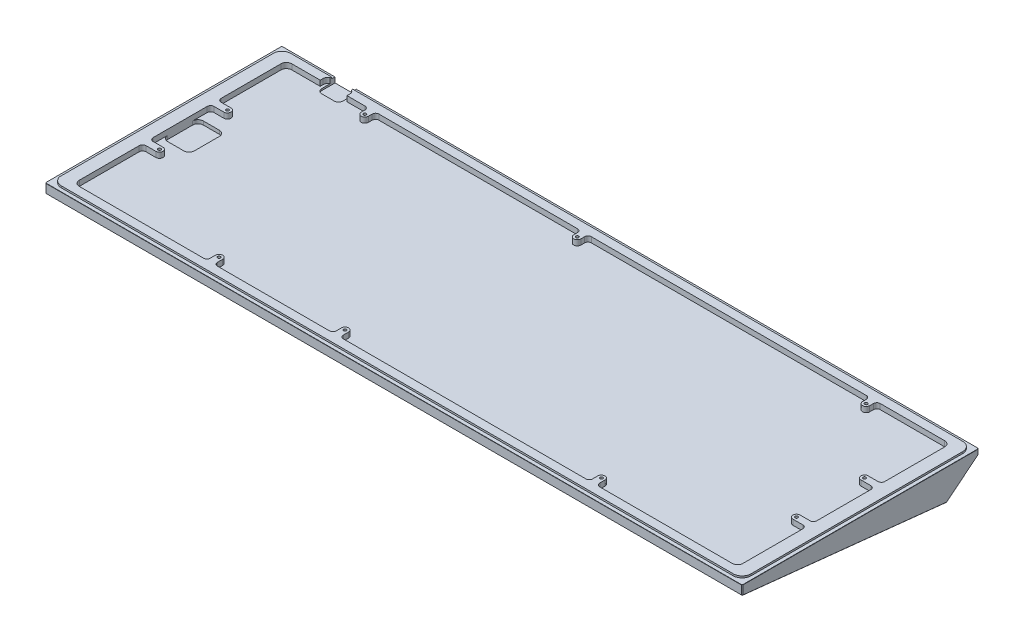
from build123d import *
from OCP.BRepFilletAPI import BRepFilletAPI_MakeChamfer

# Parameters (mm, degrees)
SKETCH1_W                 = 390.7
SKETCH1_H                 = 132.7
MAINBODY_DEPTH            = 18.5
SKETCH2_W                 = 390.7
SKETCH2_H                 = 132.7
SKETCH2_W_2               = 386.6
SKETCH2_H_2               = 128.6
ALIGMENTLIP_DEPTH         = 1
TYPINGANGLE_DEPTH         = 414.035143783
SKETCH4_W                 = 372
SKETCH4_H                 = 119.1
PCBCUTOUT_DEPTH           = 3
SKETCH13_W                = 15
SKETCH13_H                = 20
CUT_EXTRUDE4_DEPTH        = 2
FILLET2_R                 = 3
CHAMFER1_SIZE             = 0.5
CHAMFER1_SIZE_2           = 0.561801899
CHAMFER2_SIZE             = 0.1
SKETCH17_R                = 1
SKETCH17_W                = 2
SKETCH17_H                = 2
CUT_EXTRUDE5_DEPTH        = 1
SKETCH18_W                = 12
SKETCH18_H                = 4
CUT_EXTRUDE6_DEPTH        = 10
SKETCH12_W                = 15
SKETCH12_H                = 3.95
CUT_EXTRUDE3_DEPTH        = 3
FILLET1_R                 = 2.5
SKETCH19_R                = 2
SKETCH19_W                = 4
SKETCH19_H                = 4
SKETCH19_W_2              = 7.45
SKETCH19_H_2              = 4.8
BOSS_EXTRUDE1_DEPTH       = 3
FILLET3_R                 = 1.9
M2X0_4_TAPPED_HOLE1_D     = 1.6
M2X0_4_TAPPED_HOLE1_DEPTH = 4
M2X0_4_TAPPED_HOLE1_TIP   = 0.480688495
CHAMFER3_SIZE             = 0.1
FILLET4_R                 = 5
CUT_EXTRUDE7_REACH        = 414.392
SKETCH23_W                = 300
SKETCH23_H                = 70
FILLET5_R                 = 5


# Some blends are built 0.0001 mm under size
with BuildPart() as part:
    # Sketch1 → MainBody (new body)
    with BuildSketch(Plane(origin=(0, 0, 0), x_dir=(1, 0, 0), z_dir=(0, 1, 0))):
        with Locations((195.35, 66.35)):
            Rectangle(SKETCH1_W, SKETCH1_H)
    extrude(amount=MAINBODY_DEPTH)

    # Sketch2 → AligmentLip (cut)
    with BuildSketch(Plane(origin=(0, 18.5, 0), x_dir=(1, 0, 0), z_dir=(0, 1, 0))):
        with Locations((195.35, 66.35)):
            Rectangle(SKETCH2_W, SKETCH2_H)
        with Locations((195.35, 66.35)):
            Rectangle(SKETCH2_W_2, SKETCH2_H_2, mode=Mode.SUBTRACT)
    extrude(amount=-ALIGMENTLIP_DEPTH, mode=Mode.SUBTRACT)

    # Sketch3 → TypingAngle (cut, through all)
    with BuildSketch(Plane.ZY):
        Polygon((-114.79399123, 0), (-132.7, 14.5), (-132.7, 0), align=None)
        Polygon((0, 12.065334661), (-114.79399123, 0), (0, 0), align=None)
    extrude(amount=-TYPINGANGLE_DEPTH, mode=Mode.SUBTRACT)

    # Sketch4 → PCBCutout (cut)
    with BuildSketch(Plane(origin=(0, 18.5, 0), x_dir=(1, 0, 0), z_dir=(0, 1, 0))):
        with Locations((195.35, 66.35)):
            Rectangle(SKETCH4_W, SKETCH4_H)
    extrude(amount=-PCBCUTOUT_DEPTH, mode=Mode.SUBTRACT)

    # Sketch13 → Cut-Extrude4 (cut)
    with BuildSketch(Plane(origin=(0, 15.5, 0), x_dir=(1, 0, 0), z_dir=(0, 1, 0))):
        with Locations((16.85, 66.35)):
            Rectangle(SKETCH13_W, SKETCH13_H)
    extrude(amount=-CUT_EXTRUDE4_DEPTH, mode=Mode.SUBTRACT)

    # Fillet2
    fillet2_edges = [part.edges().sort_by_distance(p)[0] for p in [
        (9.35, 17, -6.8),
        (9.35, 17, -125.9),
        (381.35, 17, -125.9),
        (381.35, 17, -6.8),
        (9.35, 14.5, -56.35),
        (9.35, 14.5, -76.35),
        (24.35, 14.5, -76.35),
        (24.35, 14.5, -56.35),
    ]]
    fillet(fillet2_edges, radius=FILLET2_R)

    # Chamfer1
    chamfer1_edges_1 = [part.edges().sort_by_distance(p)[0] for p in [
        (0, 16, -132.7),
        (390.7, 16, -132.7),
        (390.7, 14.782667331, 0),
        (0, 14.782667331, 0),
        (0, 7.25, -123.746995615),
        (390.7, 7.25, -123.746995615),
        (0, 6.032667331, -57.396995615),
        (390.7, 6.032667331, -57.396995615),
    ]]
    chamfer1_edges_2 = [part.edges().sort_by_distance(p)[0] for p in [
        (195.35, 12.065334661, 0),
    ]]
    chamfer1_side_2 = [part.faces().sort_by_distance(p)[0] for p in [
        (195.35, 12.064289377, -0.009945219),
    ]]
    chamfer1 = BRepFilletAPI_MakeChamfer(part.part.solid().wrapped)
    for e in chamfer1_edges_1:
        chamfer1.Add(CHAMFER1_SIZE - 0.0001, e.wrapped)
    for e in chamfer1_edges_2:
        chamfer1.Add(CHAMFER1_SIZE_2 - 0.0001, CHAMFER1_SIZE - 0.0001, e.wrapped, chamfer1_side_2[0].wrapped)
    add(Compound.cast(chamfer1.Shape()), mode=Mode.REPLACE)  # a hair under: the kernel refuses the full size

    # Chamfer2
    chamfer2_edges = [part.edges().sort_by_distance(p)[0] for p in [
        (2.05, 18.5, -66.35),
    ]]
    chamfer(chamfer2_edges, length=CHAMFER2_SIZE)

    # Sketch17 → Cut-Extrude5 (cut)
    with BuildSketch(Plane(origin=(0, 11.933506406, -1.254262065), x_dir=(1, 0, 0), z_dir=(0, -0.9945218953682734, 0.10452846326765429))):
        with Locations((205.25, -52.238829109)):
            Circle(SKETCH17_R)
        with BuildLine():
            ThreePointArc((204.25, -52.238829109), (205.25, -51.238829109), (206.25, -52.238829109))
            Line((206.25, -52.238829109), (206.25, -49.738829109))
            ThreePointArc((206.25, -49.738829109), (205.25, -50.738829109), (204.25, -49.738829109))
            Line((204.25, -49.738829109), (204.25, -52.238829109))
        make_face()
        with Locations((205.25, -49.738829109)):
            Circle(SKETCH17_R)
        with Locations((201.75, -49.738829109)):
            Circle(SKETCH17_R)
        with BuildLine():
            ThreePointArc((200.75, -60.238829109), (201.75, -59.238829109), (202.75, -60.238829109))
            Line((202.75, -60.238829109), (202.75, -49.738829109))
            ThreePointArc((202.75, -49.738829109), (201.75, -50.738829109), (200.75, -49.738829109))
            Line((200.75, -49.738829109), (200.75, -60.238829109))
        make_face()
        with Locations((201.75, -60.238829109)):
            Circle(SKETCH17_R)
        with Locations((197.25, -53.738829109)):
            Circle(SKETCH17_R)
        with BuildLine():
            Line((196.25, -62.738829109), (198.25, -62.738829109))
            Line((198.25, -62.738829109), (198.25, -53.738829109))
            ThreePointArc((198.25, -53.738829109), (197.25, -54.738829109), (196.25, -53.738829109))
            Line((196.25, -53.738829109), (196.25, -62.738829109))
        make_face()
        with Locations((197.25, -63.738829109)):
            Rectangle(SKETCH17_W, SKETCH17_H)
        with BuildLine():
            ThreePointArc((196.25, -67.738829109), (197.25, -66.738829109), (198.25, -67.738829109))
            Line((198.25, -67.738829109), (198.25, -64.738829109))
            Line((198.25, -64.738829109), (196.25, -64.738829109))
            Line((196.25, -64.738829109), (196.25, -67.738829109))
        make_face()
        with Locations((197.25, -67.738829109)):
            Circle(SKETCH17_R)
        with BuildLine():
            Line((194.25, -64.738829109), (196.25, -64.738829109))
            Line((196.25, -64.738829109), (196.25, -62.738829109))
            Line((196.25, -62.738829109), (194.25, -62.738829109))
            ThreePointArc((194.25, -62.738829109), (194.957106781, -63.031722328), (195.25, -63.738829109))
            ThreePointArc((195.25, -63.738829109), (194.957106781, -64.44593589), (194.25, -64.738829109))
        make_face()
        with Locations((194.25, -63.738829109)):
            Circle(SKETCH17_R)
        with Locations(Location((201.75, -63.738829109, 0), (0, 0, 270))):
            Circle(SKETCH17_R)
        with Locations((192.45, -60.238829109)):
            Circle(SKETCH17_R)
        with BuildLine():
            ThreePointArc((191.45, -60.238829109), (192.45, -59.238829109), (193.45, -60.238829109))
            Line((193.45, -60.238829109), (193.45, -54.238829109))
            ThreePointArc((193.45, -54.238829109), (192.45, -55.238829109), (191.45, -54.238829109))
            Line((191.45, -54.238829109), (191.45, -60.238829109))
        make_face()
        with Locations((192.45, -54.238829109)):
            Circle(SKETCH17_R)
        with BuildLine():
            ThreePointArc((187.95, -60.238829109), (188.95, -59.238829109), (189.95, -60.238829109))
            Line((189.95, -60.238829109), (189.95, -54.238829109))
            ThreePointArc((189.95, -54.238829109), (188.95, -55.238829109), (187.95, -54.238829109))
            Line((187.95, -54.238829109), (187.95, -60.238829109))
        make_face()
        with Locations((188.95, -60.238829109)):
            Circle(SKETCH17_R)
        with Locations((188.95, -54.238829109)):
            Circle(SKETCH17_R)
        with Locations((185.45, -54.238829109)):
            Circle(SKETCH17_R)
        with BuildLine():
            ThreePointArc((184.45, -60.238829109), (185.45, -59.238829109), (186.45, -60.238829109))
            Line((186.45, -60.238829109), (186.45, -54.238829109))
            ThreePointArc((186.45, -54.238829109), (185.45, -55.238829109), (184.45, -54.238829109))
            Line((184.45, -54.238829109), (184.45, -60.238829109))
        make_face()
        with Locations((185.45, -60.238829109)):
            Circle(SKETCH17_R)
    extrude(amount=-CUT_EXTRUDE5_DEPTH, mode=Mode.SUBTRACT)

    # Sketch18 → Cut-Extrude6 (cut)
    with BuildSketch(Plane(origin=(0, 0, -132.7), x_dir=(-1, 0, 0), z_dir=(0, 0, -1))):
        with Locations((-35.8, 16.5)):
            Rectangle(SKETCH18_W, SKETCH18_H)
    extrude(amount=-CUT_EXTRUDE6_DEPTH, mode=Mode.SUBTRACT)

    # Sketch12 → Cut-Extrude3 (cut)
    with BuildSketch(Plane(origin=(0, 18.5, 0), x_dir=(1, 0, 0), z_dir=(0, 1, 0))):
        with Locations((35.8, 127.875)):
            Rectangle(SKETCH12_W, SKETCH12_H)
    extrude(amount=-CUT_EXTRUDE3_DEPTH, mode=Mode.SUBTRACT)

    # Fillet1
    # the kernel refuses this fillet: 2.5 mm, written as the material it adds along each edge
    with BuildSketch(Plane(origin=(43.3, 18.5, -129.85), x_dir=(-1, 0, 0), z_dir=(0, -1, 0))) as fillet1_piece_1_section:
        with BuildLine():
            CenterArc((2.5, -2.291287847), FILLET1_R, 113.578178478, 66.421821522)
            Line((0, -2.291287847), (0, 0))
            Line((0, 0), (1.5, 0))
        make_face()
    fillet1_piece_1 = extrude(amount=8.728219619, mode=Mode.PRIVATE)
    fillet1_piece_1 = split(fillet1_piece_1, bisect_by=Plane(origin=(42.895833366, 13.646672466, -131.646228254), z_dir=(0, 0.7771459614569701, 0.6293203910498384)), keep=Keep.TOP, mode=Mode.PRIVATE)
    add(fillet1_piece_1)
    with BuildSketch(Plane(origin=(28.3, 18.5, -129.85), x_dir=(0, 0, 1), z_dir=(0, -1, 0))) as fillet1_piece_2_section:
        with BuildLine():
            CenterArc((2.291287847, -2.5), FILLET1_R, 90, 66.421821522)
            Line((0, -1.5), (0, 0))
            Line((0, 0), (2.291287847, 0))
        make_face()
    fillet1_piece_2 = extrude(amount=8.728219619, mode=Mode.PRIVATE)
    fillet1_piece_2 = split(fillet1_piece_2, bisect_by=Plane(origin=(28.704166634, 13.646672466, -131.646228254), z_dir=(0, 0.7771459614569701, 0.6293203910498384)), keep=Keep.TOP, mode=Mode.PRIVATE)
    add(fillet1_piece_2)
    with BuildSketch(Plane(origin=(41.8, 8.25, -122.7), x_dir=(0, 0, -1), z_dir=(0, 1, 0))) as fillet1_piece_3_section:
        with BuildLine():
            CenterArc((FILLET1_R, FILLET1_R), FILLET1_R, 180, 90)
            Line((0, FILLET1_R), (0, 0))
            Line((0, 0), (FILLET1_R, 0))
        make_face()
    fillet1_piece_3 = extrude(amount=7.25, mode=Mode.PRIVATE)
    fillet1_piece_3 = split(fillet1_piece_3, bisect_by=Plane(origin=(41.241580153, 10.080392591, -127.242239377), z_dir=(0, 0.7771459614569701, 0.6293203910498384)), keep=Keep.TOP, mode=Mode.PRIVATE)
    add(fillet1_piece_3)
    with BuildSketch(Plane(origin=(29.8, 15.5, -122.7), x_dir=(1, 0, 0), z_dir=(0, -1, 0))) as fillet1_piece_4_section:
        with BuildLine():
            CenterArc((FILLET1_R, -FILLET1_R), FILLET1_R, 90, 90)
            Line((0, -FILLET1_R), (0, 0))
            Line((0, 0), (FILLET1_R, 0))
        make_face()
    fillet1_piece_4 = extrude(amount=7.25, mode=Mode.PRIVATE)
    fillet1_piece_4 = split(fillet1_piece_4, bisect_by=Plane(origin=(30.358419847, 10.080392591, -127.242239377), z_dir=(0, 0.7771459614569701, 0.6293203910498384)), keep=Keep.TOP, mode=Mode.PRIVATE)
    add(fillet1_piece_4)

    # Sketch19 → Boss-Extrude1 (add)
    with BuildSketch(Plane(origin=(0, 15.5, 0), x_dir=(1, 0, 0), z_dir=(0, 1, 0))):
        with Locations((57.3, 121.9)):
            Circle(SKETCH19_R)
        with Locations((176.4, 121.9)):
            Circle(SKETCH19_R)
        with Locations((338.3, 121.9)):
            Circle(SKETCH19_R)
        with Locations((16.8, 85.4)):
            Circle(SKETCH19_R)
        with Locations((16.8, 47.3)):
            Circle(SKETCH19_R)
        with Locations((85.9, 11.6)):
            Circle(SKETCH19_R)
        with Locations((156.5, 11.6)):
            Circle(SKETCH19_R)
        with Locations((300.2, 11.6)):
            Circle(SKETCH19_R)
        with Locations((373.9, 85.4)):
            Circle(SKETCH19_R)
        with Locations((373.9, 47.3)):
            Circle(SKETCH19_R)
        with Locations((57.3, 123.9)):
            Rectangle(SKETCH19_W, SKETCH19_H)
        with Locations((176.4, 123.9)):
            Rectangle(SKETCH19_W, SKETCH19_H)
        with Locations((338.3, 123.9)):
            Rectangle(SKETCH19_W, SKETCH19_H)
        with Locations((377.625, 85.4)):
            Rectangle(SKETCH19_W_2, SKETCH19_H)
        with Locations((377.625, 47.3)):
            Rectangle(SKETCH19_W_2, SKETCH19_H)
        with Locations((300.2, 9.2)):
            Rectangle(SKETCH19_W, SKETCH19_H_2)
        with Locations((156.5, 9.2)):
            Rectangle(SKETCH19_W, SKETCH19_H_2)
        with Locations((85.9, 9.2)):
            Rectangle(SKETCH19_W, SKETCH19_H_2)
        with Locations((13.075, 47.3)):
            Rectangle(SKETCH19_W_2, SKETCH19_H)
        with Locations((13.075, 85.4)):
            Rectangle(SKETCH19_W_2, SKETCH19_H)
    extrude(amount=BOSS_EXTRUDE1_DEPTH)

    # Fillet3
    fillet3_edges = [part.edges().sort_by_distance(p)[0] for p in [
        (9.35, 17, -87.4),
        (9.35, 17, -83.4),
        (178.4, 17, -125.9),
        (174.4, 17, -125.9),
        (381.35, 17, -87.4),
        (381.35, 17, -83.4),
        (298.2, 17, -6.8),
        (302.2, 17, -6.8),
        (87.9, 17, -6.8),
        (83.9, 17, -6.8),
        (154.5, 17, -6.8),
        (158.5, 17, -6.8),
        (381.35, 17, -49.3),
        (381.35, 17, -45.3),
        (340.3, 17, -125.9),
        (336.3, 17, -125.9),
        (59.3, 17, -125.9),
        (55.3, 17, -125.9),
        (9.35, 17, -49.3),
        (9.35, 17, -45.3),
    ]]
    fillet(fillet3_edges, radius=FILLET3_R)

    # M2x0.4 Tapped Hole1
    with Locations(Plane(origin=(57.3, 18.5, -121.9), x_dir=(0, 0, 1), z_dir=(0, 1, 0))):
        with Locations((0, 0), (0, 119.1), (74.6, -40.5), (36.5, -40.5), (110.3, 28.6), (110.3, 99.2), (110.3, 242.9), (74.6, 316.6), (36.5, 316.6), (0, 281)):
            Hole(M2X0_4_TAPPED_HOLE1_D / 2, depth=M2X0_4_TAPPED_HOLE1_DEPTH)
            with Locations((0, 0, -(M2X0_4_TAPPED_HOLE1_DEPTH + M2X0_4_TAPPED_HOLE1_TIP / 2))):  # 118° drill point
                Cone(0, M2X0_4_TAPPED_HOLE1_D / 2, M2X0_4_TAPPED_HOLE1_TIP, mode=Mode.SUBTRACT)

    # Chamfer3
    chamfer3_edges = [part.edges().sort_by_distance(p)[0] for p in [
        (195.35, 17.5, 0),
        (216.00005, 17.5, -132.7),
        (390.7, 17.5, -66.35),
        (0, 17.5, -66.35),
        (15.14995, 17.5, -132.7),
    ]]
    chamfer(chamfer3_edges, length=CHAMFER3_SIZE)

    # Fillet4
    fillet4_edges = [part.edges().sort_by_distance(p)[0] for p in [
        (388.65, 18, -2.05),
        (388.65, 18, -130.65),
        (2.05, 17.95, -2.05),
        (2.05, 17.95, -130.65),
    ]]
    fillet(fillet4_edges, radius=FILLET4_R)

    # Cut-Extrude7: up to this plane
    cut_extrude7_end = Plane(origin=(0, 13, 0), z_dir=(0, 1, 0))
    # Sketch23 → Cut-Extrude7 (cut, up to the surface)
    with BuildSketch(Plane(origin=(0, 11.933506406, -1.254262065), x_dir=(1, 0, 0), z_dir=(0, -0.9945218953682734, 0.10452846326765429)), mode=Mode.PRIVATE) as cut_extrude7_sk1:
        with Locations((195.35, -56.732884371)):
            Rectangle(SKETCH23_W, SKETCH23_H)
    cut_extrude7_tool1 = split(extrude(cut_extrude7_sk1.sketch, amount=-CUT_EXTRUDE7_REACH, mode=Mode.PRIVATE), bisect_by=cut_extrude7_end, keep=Keep.BOTH, mode=Mode.PRIVATE)
    add(cut_extrude7_tool1.solids().sort_by_distance((195.35, 6.003305, -57.676358))[0], mode=Mode.SUBTRACT)

    # Fillet5
    fillet5_edges = [part.edges().sort_by_distance(p)[0] for p in [
        (45.35, 11.3309007, -23.043520827),
        (45.35, 7.672404486, -93.04457695),
        (345.35, 7.672404486, -93.04457695),
        (345.35, 11.3309007, -23.043520827),
    ]]
    fillet(fillet5_edges, radius=FILLET5_R)


solid = part.part
